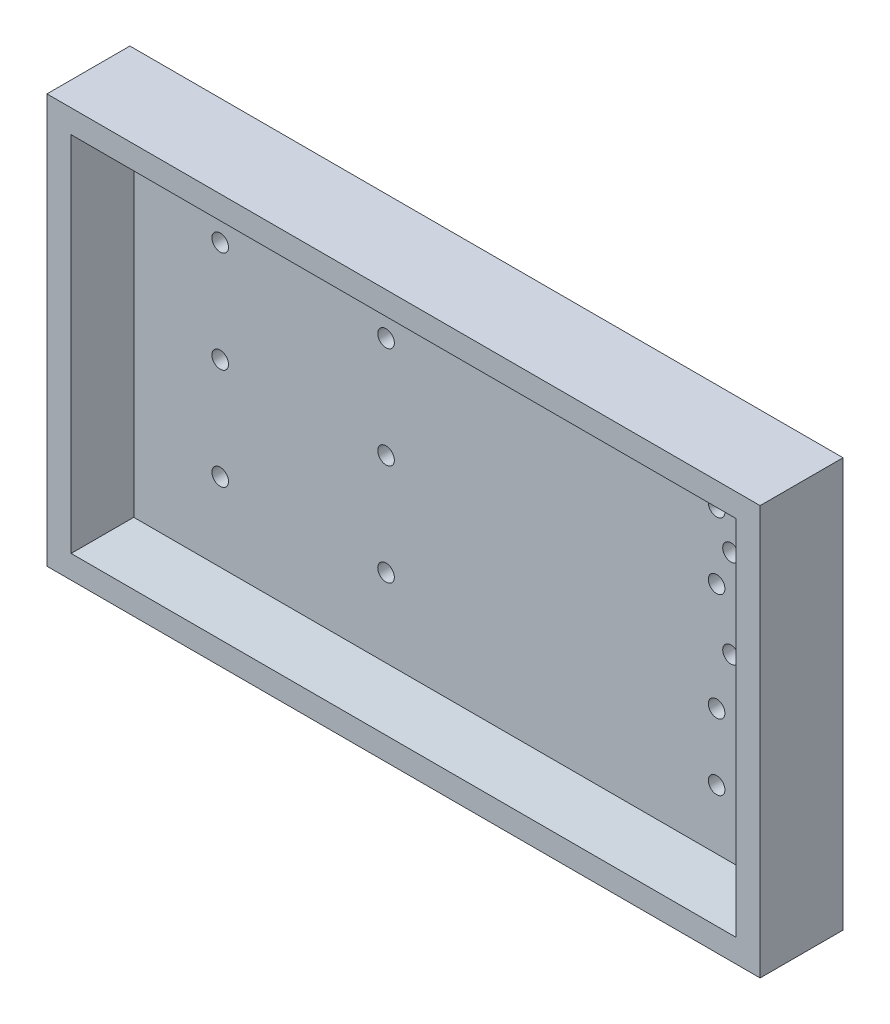
from build123d import *

# Parameters (mm, degrees)
SKETCH1_W           = 129
SKETCH1_H           = 74
BOSS_EXTRUDE1_DEPTH = 39
SKETCH2_R           = 1.5
CUT_EXTRUDE1_DEPTH  = 10
SKETCH4_W           = 129
SKETCH4_H           = 24
CUT_EXTRUDE3_DEPTH  = 100


with BuildPart() as part:
    # Sketch1 → Boss-Extrude1 (new body)
    with BuildSketch(Plane.XY):
        with Locations((64.5, 37)):
            Rectangle(SKETCH1_W, SKETCH1_H)
    extrude(amount=-BOSS_EXTRUDE1_DEPTH)

    # Sketch2 → Cut-Extrude1 (cut)
    with BuildSketch(Plane(origin=(0, 0, -39), x_dir=(-1, 0, 0), z_dir=(0, 0, -1))):
        with Locations((-50.3, 37)):
            Circle(SKETCH2_R)
        with Locations((-50.3, 55.35)):
            Circle(SKETCH2_R)
        with Locations((-50.3, 18.65)):
            Circle(SKETCH2_R)
        with Locations((-20.3, 55.35)):
            Circle(SKETCH2_R)
        with Locations((-20.3, 37)):
            Circle(SKETCH2_R)
        with Locations((-20.3, 18.65)):
            Circle(SKETCH2_R)
        with Locations((-112.7, 37)):
            Circle(SKETCH2_R)
        with Locations((-112.7, 53)):
            Circle(SKETCH2_R)
        with Locations((-110.1, 58.75)):
            Circle(SKETCH2_R)
        with Locations((-110.1, 46.75)):
            Circle(SKETCH2_R)
        with Locations((-110.1, 15.25)):
            Circle(SKETCH2_R)
        with Locations((-110.1, 27.25)):
            Circle(SKETCH2_R)
    extrude(amount=-CUT_EXTRUDE1_DEPTH, mode=Mode.SUBTRACT)

    # Cavity1: read off the stored shape, not the designer's step
    # Cavity1: loft between two sections, ruled curve by curve
    cavity1_from = [
        Edge.make_line((125.249, 3.561625, 0), (125.249, 70.427375, 0)),
        Edge.make_line((3.746, 3.561625, 0), (125.249, 3.561625, 0)),
        Edge.make_line((3.746, 70.427375, 0), (3.746, 3.561625, 0)),
        Edge.make_line((125.249, 70.427375, 0), (3.746, 70.427375, 0)),
    ]
    cavity1_to = [
        Edge.make_line((124.330201477, 4.483173045, -35.035), (124.330201477, 69.505826955, -35.035)),
        Edge.make_line((4.664798523, 4.483173045, -35.035), (124.330201477, 4.483173045, -35.035)),
        Edge.make_line((4.664798523, 69.505826955, -35.035), (4.664798523, 4.483173045, -35.035)),
        Edge.make_line((124.330201477, 69.505826955, -35.035), (4.664798523, 69.505826955, -35.035)),
    ]
    cavity1 = Solid(Shell([*[Face.make_surface_from_curves(cavity1_from[k], cavity1_to[k]) for k in range(4)], Face(Wire(cavity1_from)), Face(Wire(cavity1_to))]))
    add(cavity1, mode=Mode.SUBTRACT)

    # Sketch4 → Cut-Extrude3 (cut)
    with BuildSketch(Plane(origin=(0, 74, 0), x_dir=(1, 0, 0), z_dir=(0, 1, 0))):
        with Locations((64.5, 12)):
            Rectangle(SKETCH4_W, SKETCH4_H)
    extrude(amount=-CUT_EXTRUDE3_DEPTH, mode=Mode.SUBTRACT)


solid = part.part
